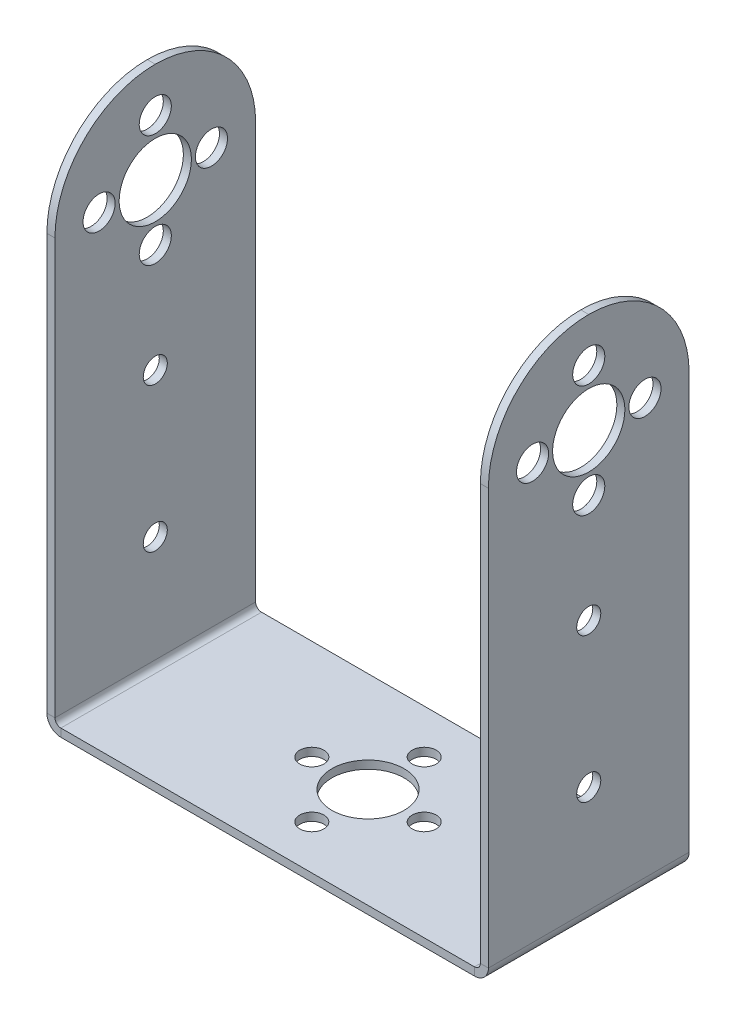
from build123d import *

# Parameters (mm, degrees)
SKETCH1_W                      = 53
SKETCH1_H                      = 25
SKETCH1_R                      = 4.5
SKETCH1_R_2                    = 1.5
BASE_FLANGE1_DEPTH             = 1
EDGE_FLANGE1_STRIP_W           = 5.4732
EDGE_FLANGE1_STRIP_H           = 1
EDGE_FLANGE1_STRIP_CUT_DEPTH   = 25
EDGE_FLANGE1_STRIP_2_W         = 5.4732
EDGE_FLANGE1_STRIP_2_H         = 1
EDGE_FLANGE1_STRIP_CUT_2_DEPTH = 25
EDGE_FLANGE1_DEPTH             = 25
EDGE_FLANGE1_BEND_DEPTH        = 25
CUT_EXTRUDE1_DEPTH             = 73.584433593
CUT_EXTRUDE1_DEPTH_BACK        = 73.584433593
SKETCH13_R                     = 4.5
SKETCH13_R_2                   = 2
SKETCH13_R_3                   = 1.5
FILLET1_R                      = 12.5


# Sheet-metal steps are written as plain solids
with BuildPart() as part:
    # Sketch1 → Base-Flange1 (new body)
    with BuildSketch(Plane(origin=(0, 0, 0), x_dir=(1, 0, 0), z_dir=(0, 1, 0))):
        Rectangle(SKETCH1_W, SKETCH1_H)
        with Locations(Location((0, 0, 0), (0, 0, 270))):
            Circle(SKETCH1_R, mode=Mode.SUBTRACT)
        with Locations(Location((-7, 0, 0), (0, 0, 270))):
            Circle(SKETCH1_R_2, mode=Mode.SUBTRACT)
        with Locations(Location((7, 0, 0), (0, 0, 270))):
            Circle(SKETCH1_R_2, mode=Mode.SUBTRACT)
        with Locations(Location((0, 7, 0), (0, 0, 270))):
            Circle(SKETCH1_R_2, mode=Mode.SUBTRACT)
        with Locations(Location((0, -7, 0), (0, 0, 270))):
            Circle(SKETCH1_R_2, mode=Mode.SUBTRACT)
    extrude(amount=BASE_FLANGE1_DEPTH)

    # Edge-Flange1 strip (across the edge) → Edge-Flange1 strip cut (cut)
    with BuildSketch(Plane(origin=(-26.5, 1, -12.5), x_dir=(1, 0, 0), z_dir=(0, 0, 1))):
        with Locations((-2, -0.5)):
            Rectangle(EDGE_FLANGE1_STRIP_W, EDGE_FLANGE1_STRIP_H)
    extrude(amount=EDGE_FLANGE1_STRIP_CUT_DEPTH, mode=Mode.SUBTRACT)

    # Edge-Flange1 strip 2 (across the edge) → Edge-Flange1 strip cut 2 (cut)
    with BuildSketch(Plane(origin=(26.5, 1, 12.5), x_dir=(-1, 0, 0), z_dir=(0, 0, -1))):
        with Locations((-2, -0.5)):
            Rectangle(EDGE_FLANGE1_STRIP_2_W, EDGE_FLANGE1_STRIP_2_H)
    extrude(amount=EDGE_FLANGE1_STRIP_CUT_2_DEPTH, mode=Mode.SUBTRACT)

    # Edge-Flange1 section (across the edge) → Edge-Flange1 (add)
    with BuildSketch(Plane(origin=(-26.5, 1, -12.5), x_dir=(1, 0, 0), z_dir=(0, 0, 1))):
        with BuildLine():
            Line((-1, 0.7366), (-1, 65))
            Line((-1, 65), (0, 65))
            Line((0, 65), (0, 0.7366))
            ThreePointArc((0, 0.7366), (0.215745145, 0.215745145), (0.7366, 0))
            Line((0.7366, 0), (0.7366, -1))
            ThreePointArc((0.7366, -1), (-0.491361636, -0.491361636), (-1, 0.7366))
        make_face()
    extrude(amount=EDGE_FLANGE1_DEPTH)

    # Edge-Flange1 section 2 (across the edge) → Edge-Flange1 bend (add)
    with BuildSketch(Plane(origin=(26.5, 1, 12.5), x_dir=(-1, 0, 0), z_dir=(0, 0, -1))):
        with BuildLine():
            Line((-1, 0.7366), (-1, 65))
            Line((-1, 65), (0, 65))
            Line((0, 65), (0, 0.7366))
            ThreePointArc((0, 0.7366), (0.215745145, 0.215745145), (0.7366, 0))
            Line((0.7366, 0), (0.7366, -1))
            ThreePointArc((0.7366, -1), (-0.491361636, -0.491361636), (-1, 0.7366))
        make_face()
    extrude(amount=EDGE_FLANGE1_BEND_DEPTH)

    # Sketch13 → Cut-Extrude1 (cut, two sides: drawn at the far end of the back side and taken through both)
    with BuildSketch(Plane(origin=(0, 0, 0), x_dir=(0, 0, -1), z_dir=(1, 0, 0)).offset(-CUT_EXTRUDE1_DEPTH_BACK)):
        with Locations((0, 53.5)):
            Circle(SKETCH13_R)
        with Locations((-7, 53.5)):
            Circle(SKETCH13_R_2)
        with Locations((7, 53.5)):
            Circle(SKETCH13_R_2)
        with Locations((0, 46.5)):
            Circle(SKETCH13_R_2)
        with Locations((0, 60.5)):
            Circle(SKETCH13_R_2)
        with Locations((0, 33)):
            Circle(SKETCH13_R_3)
        with Locations((0, 15)):
            Circle(SKETCH13_R_3)
    extrude(amount=CUT_EXTRUDE1_DEPTH + CUT_EXTRUDE1_DEPTH_BACK, mode=Mode.SUBTRACT)

    # Fillet1
    fillet1_edges = [part.edges().sort_by_distance(p)[0] for p in [
        (-27, 66, -12.5),
        (-27, 66, 12.5),
        (27, 66, -12.5),
        (27, 66, 12.5),
    ]]
    fillet(fillet1_edges, radius=FILLET1_R - 0.0001)  # a hair under: the kernel refuses the full size


solid = part.part
